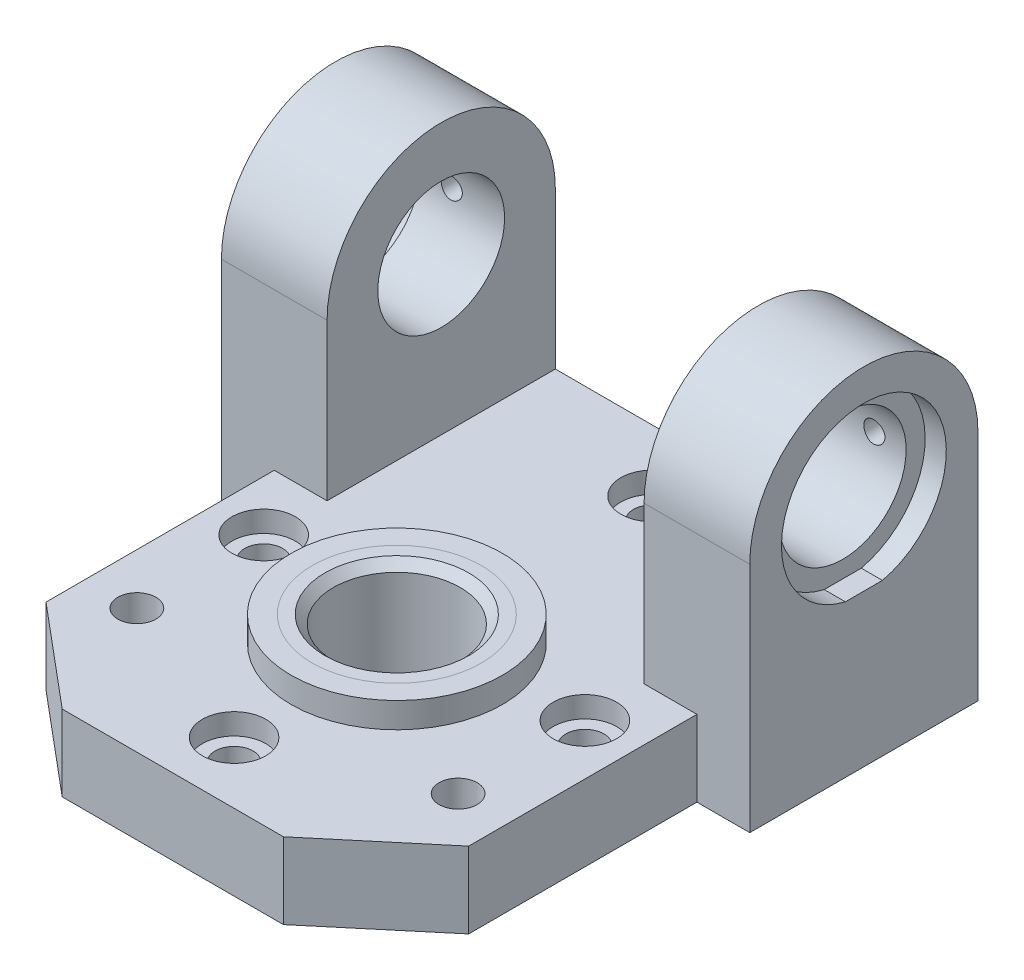
from build123d import *

# Parameters (mm, degrees)
SKETCH_2_R               = 4.5
EXTRUDE_1_DEPTH          = 9
SKETCH_3_R               = 7.5
CUT_EXTRUDE_1_DEPTH      = 5
SKETCH_4_R               = 15
EXTRUDE_2_DEPTH          = 12.5
SKETCH_9_R               = 19.5
CUT_EXTRUDE_5_DEPTH      = 5
MIRROR_START             = -62.5
MIRROR_2_OUTLINE_R       = 15
MIRROR_2_DEPTH           = 25
MIRROR_START_2           = 37.5
MIRROR_2_2_OUTLINE_R     = 15
MIRROR_2_2_DEPTH         = 25
CUT_EXTRUDE_6_DEPTH      = 122.289941875
CUT_EXTRUDE_6_DEPTH_BACK = 122.289941875
SKETCH_12_W              = 125
SKETCH_12_H              = 52.775664422
CUT_EXTRUDE_7_DEPTH      = 194.230432386
CUT_EXTRUDE_7_DEPTH_BACK = 5
SKETCH_16_R              = 19.5
EXTRUDE_4_DEPTH          = 6
EXTRUDE_4_DEPTH_BACK     = 44
SKETCH_18_R              = 20
SKETCH_18_R_2            = 15
CHAMFER_1_SIZE           = 2
EXTRUDE_5_DEPTH          = 6
EXTRUDE_5_DEPTH_BACK     = 24
SKETCH_19_R              = 25
SKETCH_19_R_2            = 20
CUT_EXTRUDE_8_DEPTH      = 157.160974719
CUT_EXTRUDE_8_DEPTH_BACK = 157.160974719
SKETCH_20_R              = 15


# Read off the part's stored shape, not the designer's step: 镜向2, M6 螺纹孔3
with BuildPart() as part:
    # 草图2 → 凸台-拉伸1 (new, symmetric)
    with BuildSketch(Plane(origin=(0, 0, 0), x_dir=(1, 0, 0), z_dir=(0, 1, 0))):
        Polygon((50, 0), (-50, 0), (-50, -108), (-26.164928148, -128), (26.164928148, -128), (50, -108), align=None)
        with Locations(Location((0, -14.5, 0), (0, 0, 270))):
            Circle(SKETCH_2_R, mode=Mode.SUBTRACT)
        with Locations(Location((-38, -68.5, 0), (0, 0, 270))):
            Circle(SKETCH_2_R, mode=Mode.SUBTRACT)
        with Locations(Location((-38, -98.5, 0), (0, 0, 270))):
            Circle(SKETCH_2_R, mode=Mode.SUBTRACT)
        with Locations(Location((0, -113.5, 0), (0, 0, 270))):
            Circle(SKETCH_2_R, mode=Mode.SUBTRACT)
        with Locations(Location((38, -98.5, 0), (0, 0, 90))):
            Circle(SKETCH_2_R, mode=Mode.SUBTRACT)
        with Locations(Location((38, -68.5, 0), (0, 0, 90))):
            Circle(SKETCH_2_R, mode=Mode.SUBTRACT)
    extrude(amount=EXTRUDE_1_DEPTH, both=True)

    # 草图3 → 切除-拉伸1 (cut)
    with BuildSketch(Plane(origin=(0, 9, 0), x_dir=(1, 0, 0), z_dir=(0, 1, 0))):
        with Locations(Location((-38, -68.5, 0), (0, 0, 270))):
            Circle(SKETCH_3_R)
        with Locations(Location((0, -113.5, 0), (0, 0, 270))):
            Circle(SKETCH_3_R)
        with Locations(Location((38, -68.5, 0), (0, 0, 270))):
            Circle(SKETCH_3_R)
        with Locations(Location((0, -14.5, 0), (0, 0, 270))):
            Circle(SKETCH_3_R)
    extrude(amount=-CUT_EXTRUDE_1_DEPTH, mode=Mode.SUBTRACT)

    # 草图4 → 凸台-拉伸2 (add, symmetric)
    with BuildSketch(Plane(origin=(50, 0, 0), x_dir=(0, 0, -1), z_dir=(1, 0, 0))):
        with BuildLine():
            Line((0, -9), (-54, -9))
            Line((-54, -9), (-54, 46))
            ThreePointArc((-54, 46), (-27, 73), (0, 46))
            Line((0, 46), (0, -9))
        make_face()
        with Locations((-27, 46)):
            Circle(SKETCH_4_R, mode=Mode.SUBTRACT)
    extrude(amount=EXTRUDE_2_DEPTH, both=True)

    # 草图9 → 切除-拉伸5 (cut)
    with BuildSketch(Plane(origin=(62.5, 0, 0), x_dir=(0, 0, -1), z_dir=(1, 0, 0))):
        with Locations((-27, 46)):
            Circle(SKETCH_9_R)
    extrude(amount=-CUT_EXTRUDE_5_DEPTH, mode=Mode.SUBTRACT)

    # 镜向2 outline → 镜向2 (add)
    with BuildSketch(Plane.YZ.offset(MIRROR_START)):
        with BuildLine():
            ThreePointArc((46, 0), (73, 27), (46, 54))
            Line((46, 54), (-28, 54))
            ThreePointArc((-28, 54), (-55, 27), (-28, 0))
            Line((-28, 0), (46, 0))
        make_face()
        with Locations((46, 27)):
            Circle(MIRROR_2_OUTLINE_R, mode=Mode.SUBTRACT)
        with Locations((-28, 27)):
            Circle(MIRROR_2_OUTLINE_R, mode=Mode.SUBTRACT)
    extrude(amount=MIRROR_2_DEPTH)

    # Mirror 2 2 outline → Mirror 2 2 (add)
    # profile 1 of 2: a face of its own
    with BuildSketch(Plane.YZ.offset(MIRROR_START_2)):
        with BuildLine():
            Line((-28, 0), (-9, 0))
            Line((-9, 0), (-9, 54))
            Line((-9, 54), (-28, 54))
            ThreePointArc((-28, 54), (-55, 27), (-28, 0))
        make_face()
        with Locations((-28, 27)):
            Circle(MIRROR_2_2_OUTLINE_R, mode=Mode.SUBTRACT)
    # profile 2 of 2: a face of its own
    with BuildSketch(Plane.YZ.offset(MIRROR_START_2)):
        with BuildLine():
            Line((27, 22.612517806), (27, 31.387482194))
            ThreePointArc((27, 31.387482194), (26.5, 27), (27, 22.612517806))
        make_face()
    extrude(amount=MIRROR_2_2_DEPTH)

    # 草图12 → 切除-拉伸6 (cut, two sides: drawn at the far end of the back side and taken through both)
    with BuildSketch(Plane.XY.offset(54).offset(-CUT_EXTRUDE_6_DEPTH_BACK)):
        with Locations((0, -35.387832211)):
            Rectangle(SKETCH_12_W, SKETCH_12_H)
    extrude(amount=CUT_EXTRUDE_6_DEPTH + CUT_EXTRUDE_6_DEPTH_BACK, mode=Mode.SUBTRACT)

    # 草图16 → 切除-拉伸7 (cut, two sides: drawn at the far end of the back side and taken through both)
    with BuildSketch(Plane.ZY.offset(62.5).offset(-CUT_EXTRUDE_7_DEPTH_BACK)):
        with Locations(Location((27, 46, 0), (0, 0, 180))):
            Circle(SKETCH_16_R)
    extrude(amount=CUT_EXTRUDE_7_DEPTH + CUT_EXTRUDE_7_DEPTH_BACK, mode=Mode.SUBTRACT)

    # M6 螺纹孔3 outline → M6 螺纹孔3 (revolve, cut)
    with BuildSketch(Plane(origin=(-50, 46, 0), x_dir=(1, 0, 0), z_dir=(0, -1, 0))):
        Polygon((0, -1.887e-06), (3.025001887, -1.887e-06), (2.5, 0.525), (2.5, 12.209891195), (0, 12.209891195), align=None)
    revolve(axis=Axis((-50, 46, 0), (0, 0, 1)), mode=Mode.SUBTRACT)

    # Hole Wizard M6 _3 2 outline → Hole Wizard M6 _3 2 (revolve, cut)
    with BuildSketch(Plane(origin=(50, 46, 0), x_dir=(1, 0, 0), z_dir=(0, -1, 0))):
        Polygon((2.5, 0.525), (2.5, 12.209891195), (0, 12.209891195), (0, -1.887e-06), (3.025001887, -1.887e-06), align=None)
    revolve(axis=Axis((50, 46, 0), (0, 0, 1)), mode=Mode.SUBTRACT)

    # 草图18 → 凸台-拉伸4 (add, two sides: drawn at the far end of the back side and taken through both)
    with BuildSketch(Plane(origin=(0, 9, 0), x_dir=(1, 0, 0), z_dir=(0, 1, 0)).offset(-EXTRUDE_4_DEPTH_BACK)):
        with Locations(Location((0, -75, 0), (0, 0, 270))):
            Circle(SKETCH_18_R)
        with Locations(Location((0, -75, 0), (0, 0, 270))):
            Circle(SKETCH_18_R_2, mode=Mode.SUBTRACT)
    extrude(amount=EXTRUDE_4_DEPTH + EXTRUDE_4_DEPTH_BACK)

    # 倒角1
    chamfer_1_edges = [part.edges().sort_by_distance(p)[0] for p in [
        (0, 15, 60),
    ]]
    chamfer(chamfer_1_edges, length=CHAMFER_1_SIZE)

    # 草图20 → 切除-拉伸8 (cut, two sides: drawn at the far end of the back side and taken through both)
    with BuildSketch(Plane(origin=(0, 9, 0), x_dir=(1, 0, 0), z_dir=(0, 1, 0)).offset(-CUT_EXTRUDE_8_DEPTH_BACK)):
        with Locations(Location((0, -75, 0), (0, 0, 270))):
            Circle(SKETCH_20_R)
    extrude(amount=CUT_EXTRUDE_8_DEPTH + CUT_EXTRUDE_8_DEPTH_BACK, mode=Mode.SUBTRACT)


with BuildPart() as body_2:
    # 草图19 → 凸台-拉伸5 (new, two sides: drawn at the far end of the back side and taken through both)
    with BuildSketch(Plane(origin=(0, 9, 0), x_dir=(1, 0, 0), z_dir=(0, 1, 0)).offset(-EXTRUDE_5_DEPTH_BACK)):
        with Locations(Location((0, -75, 0), (0, 0, 270))):
            Circle(SKETCH_19_R)
        with Locations(Location((0, -75, 0), (0, 0, 270))):
            Circle(SKETCH_19_R_2, mode=Mode.SUBTRACT)
    extrude(amount=EXTRUDE_5_DEPTH + EXTRUDE_5_DEPTH_BACK)


solid = Compound([part.part, body_2.part])
